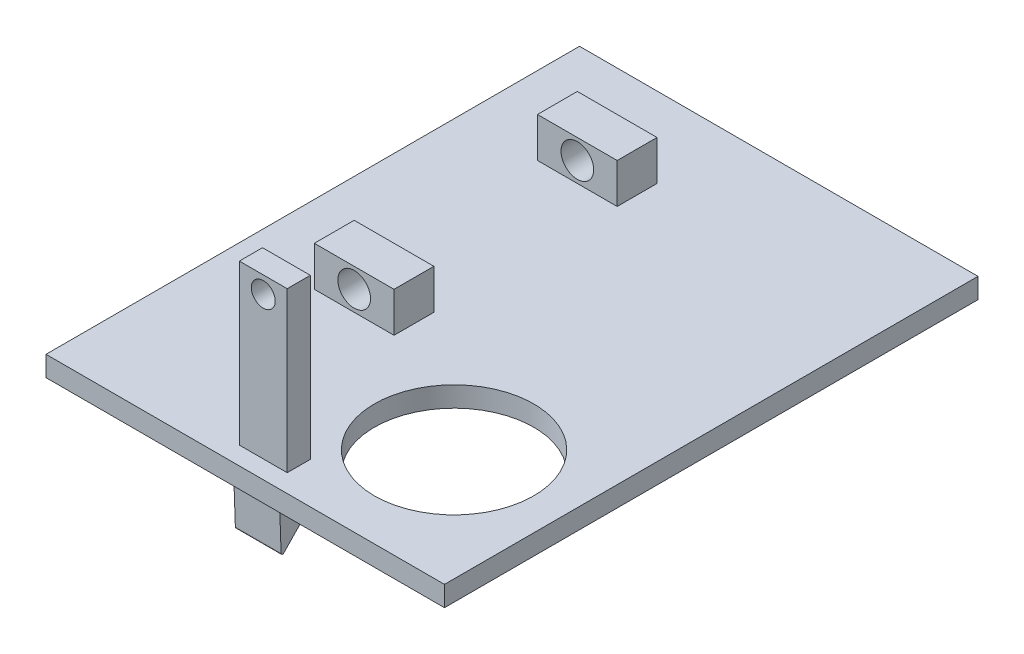
from build123d import *

# Parameters (mm, degrees)
SKETCH1_W                = 50
SKETCH1_H                = 66.947148402
SKETCH1_R                = 10
SKETCH1_W_2              = 10
SKETCH1_H_2              = 5
BOSS_EXTRUDE1_DEPTH      = 2.54
BOSS_EXTRUDE2_DEPTH      = 5
BOSS_EXTRUDE2_DEPTH_BACK = 2.54
SKETCH2_W                = 10
SKETCH2_H                = 5
SKETCH3_R                = 2.05
CUT_EXTRUDE1_DEPTH       = 41
SKETCH4_W                = 6
SKETCH4_H                = 2.904570335
BOSS_EXTRUDE3_DEPTH      = 20
SKETCH5_R                = 1.5
CUT_EXTRUDE2_DEPTH       = 20
SKETCH6_W                = 5.734558075
SKETCH6_H                = 6.4250327
BOSS_EXTRUDE4_DEPTH      = 10
DRAFT1_ANGLE             = -1
DRAFT2_START             = 371.742315671
DRAFT2_OUTLINE_W         = 10
DRAFT2_OUTLINE_H         = 6.426011413
DRAFT2_DEPTH             = 1.257684329
DRAFT3_START             = -2
DRAFT3_OUTLINE_W         = 9
DRAFT3_OUTLINE_H         = 10
DRAFT3_DEPTH             = 0.836252296
DRAFT4_ANGLE             = 1
CHAMFER1_SIZE            = 10
CHAMFER1_SIZE_2          = 10.179201911
FILLET2_R                = 0.2


with BuildPart() as part:
    # Sketch1 → Boss-Extrude1 (new body)
    with BuildSketch(Plane(origin=(0, 0, 0), x_dir=(1, 0, 0), z_dir=(0, 1, 0))):
        with Locations((377.767738439, -474.515341444)):
            Rectangle(SKETCH1_W, SKETCH1_H)
        with Locations(Location((388.753012651, -492.770944419, 0), (0, 0, 270))):
            Circle(SKETCH1_R, mode=Mode.SUBTRACT)
        with Locations((367.539675888, -481.590375858)):
            Rectangle(SKETCH1_W_2, SKETCH1_H_2, mode=Mode.SUBTRACT)
        with Locations((367.539675888, -453.590375858)):
            Rectangle(SKETCH1_W_2, SKETCH1_H_2, mode=Mode.SUBTRACT)
    extrude(amount=BOSS_EXTRUDE1_DEPTH)

    # Sketch2 → Boss-Extrude2 (add, two sides: drawn at the far end of the back side and taken through both)
    with BuildSketch(Plane(origin=(0, 2.54, 0), x_dir=(1, 0, 0), z_dir=(0, 1, 0)).offset(-BOSS_EXTRUDE2_DEPTH_BACK)):
        with Locations((367.539675888, -453.590375858)):
            Rectangle(SKETCH2_W, SKETCH2_H)
        with Locations((367.539675888, -481.590375858)):
            Rectangle(SKETCH2_W, SKETCH2_H)
    extrude(amount=BOSS_EXTRUDE2_DEPTH + BOSS_EXTRUDE2_DEPTH_BACK)

    # Sketch3 → Cut-Extrude1 (cut)
    with BuildSketch(Plane(origin=(0, 0, 451.090375858), x_dir=(-1, 0, 0), z_dir=(0, 0, -1))):
        with Locations((-367.539675888, 5.04)):
            Circle(SKETCH3_R)
    extrude(amount=-CUT_EXTRUDE1_DEPTH, mode=Mode.SUBTRACT)

    # Sketch4 → Boss-Extrude3 (add)
    with BuildSketch(Plane(origin=(0, 2.54, 0), x_dir=(1, 0, 0), z_dir=(0, 1, 0))):
        with Locations((377.767738439, -504.273195611)):
            Rectangle(SKETCH4_W, SKETCH4_H)
    extrude(amount=BOSS_EXTRUDE3_DEPTH)

    # Sketch5 → Cut-Extrude2 (cut)
    with BuildSketch(Plane.XY.offset(505.725480778)):
        with Locations((377.767738439, 20.423645689)):
            Circle(SKETCH5_R)
    extrude(amount=-CUT_EXTRUDE2_DEPTH, mode=Mode.SUBTRACT)

    # Sketch6 → Boss-Extrude4 (add)
    with BuildSketch(Plane(origin=(0, 0, 0), x_dir=(-1, 0, 0), z_dir=(0, -1, 0))):
        with Locations((-377.767738439, -503.005882789)):
            Rectangle(SKETCH6_W, SKETCH6_H)
    extrude(amount=BOSS_EXTRUDE4_DEPTH)

    # Draft1
    draft1_faces = [part.faces().sort_by_distance(p)[0] for p in [
        (374.900459401, -5, 503.005882789),
    ]]
    draft(draft1_faces, Plane(origin=(374.900459401, -10, 506.218399139), x_dir=(1, 0, 0), z_dir=(0, 0, 1)), DRAFT1_ANGLE)

    # Draft2: read off the stored shape, not the designer's step
    # Draft2 outline → Draft2 (cut)
    with BuildSketch(Plane(origin=(0, 0, 0), x_dir=(0, 1, 0), z_dir=(0.9998476951563913, 0, -0.017452406437283505)).offset(DRAFT2_START)):
        with Locations((-5, 509.571290948)):
            Rectangle(DRAFT2_OUTLINE_W, DRAFT2_OUTLINE_H)
    extrude(amount=DRAFT2_DEPTH, mode=Mode.SUBTRACT)

    # Draft3: read off the stored shape, not the designer's step
    # Draft3 outline → Draft3 (cut)
    with BuildSketch(Plane(origin=(0, 0, 0), x_dir=(1, 0, 0), z_dir=(0, 0.9998476951563913, 0.017452406437283505)).offset(DRAFT3_START)):
        with Locations((377.5, -503)):
            Rectangle(DRAFT3_OUTLINE_W, DRAFT3_OUTLINE_H)
    extrude(amount=DRAFT3_DEPTH, mode=Mode.SUBTRACT)

    # Draft4
    draft4_faces = [part.faces().sort_by_distance(p)[0] for p in [
        (377.767738439, -5, 506.218399139),
    ]]
    draft(draft4_faces, Plane(origin=(374.900459401, -10, 506.218399139), x_dir=(0, 0.017452406437283553, -0.9998476951563913), z_dir=(0, -0.9998476951563913, -0.017452406437283553)), DRAFT4_ANGLE)

    # Chamfer1
    # the kernel refuses this chamfer: 10.179201911, 10 mm, written as the material it takes off along each edge
    with BuildSketch(Plane(origin=(348.822826033, -9.887850637, 499.793366439), x_dir=(0, 1, 0), z_dir=(1, 0, 0))) as chamfer1_piece_1_section:
        Polygon((CHAMFER1_SIZE, 0), (-CHAMFER1_SIZE_2 * 0.0174524064368, CHAMFER1_SIZE_2 * 0.999847695128), (0, 0), align=None)
    chamfer1_piece_1 = extrude(amount=57.889824811, mode=Mode.PRIVATE)
    chamfer1_piece_1 = split(chamfer1_piece_1, bisect_by=Plane(origin=(348.822826033, 0, 499.793366439), z_dir=(0, -1, 0)), keep=Keep.TOP, mode=Mode.PRIVATE)
    add(chamfer1_piece_1, mode=Mode.SUBTRACT)

    # Fillet2
    fillet2_edges = [part.edges().sort_by_distance(p)[0] for p in [
        (377.767738438, -6.437295713, 506.342811514),
    ]]
    fillet(fillet2_edges, radius=FILLET2_R)


solid = part.part
